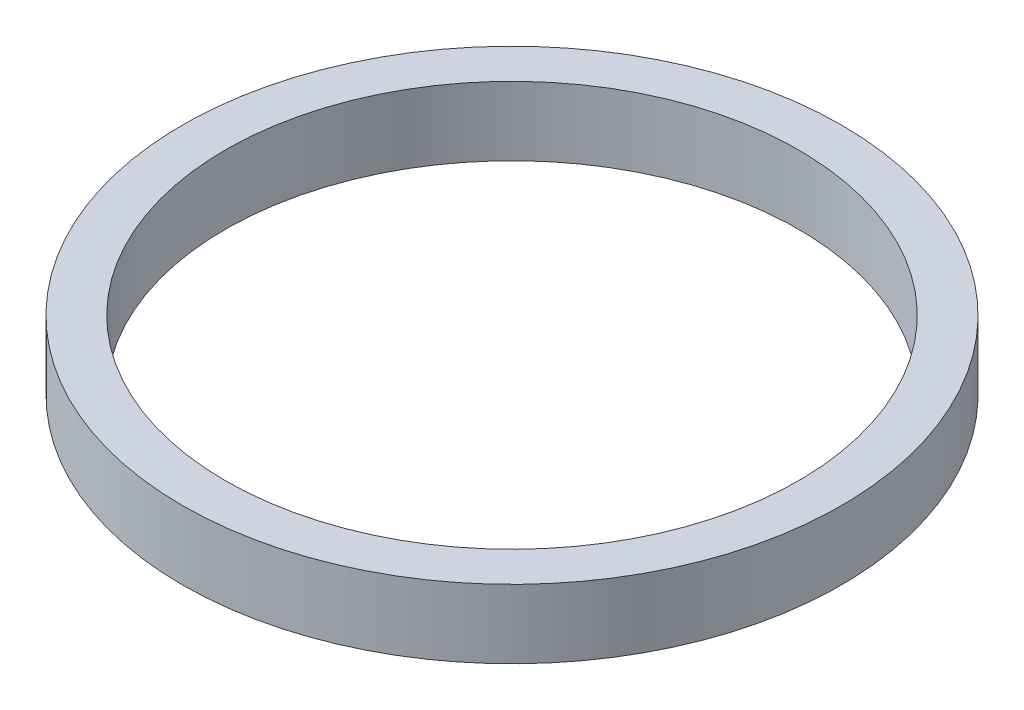
from build123d import *

# Parameters (mm, degrees)
SKETCH1_R           = 57.5
BOSS_EXTRUDE1_DEPTH = 12
SKETCH2_R           = 50
CUT_EXTRUDE1_DEPTH  = 83.197931847


with BuildPart() as part:
    # Sketch1 → Boss-Extrude1 (new body)
    with BuildSketch(Plane(origin=(0, 0, 0), x_dir=(1, 0, 0), z_dir=(0, 1, 0))):
        Circle(SKETCH1_R)
    extrude(amount=BOSS_EXTRUDE1_DEPTH)

    # Sketch2 → Cut-Extrude1 (cut, through all)
    with BuildSketch(Plane(origin=(0, 0, 0), x_dir=(1, 0, 0), z_dir=(0, 1, 0))):
        Circle(SKETCH2_R)
    extrude(amount=CUT_EXTRUDE1_DEPTH, mode=Mode.SUBTRACT)


solid = part.part
